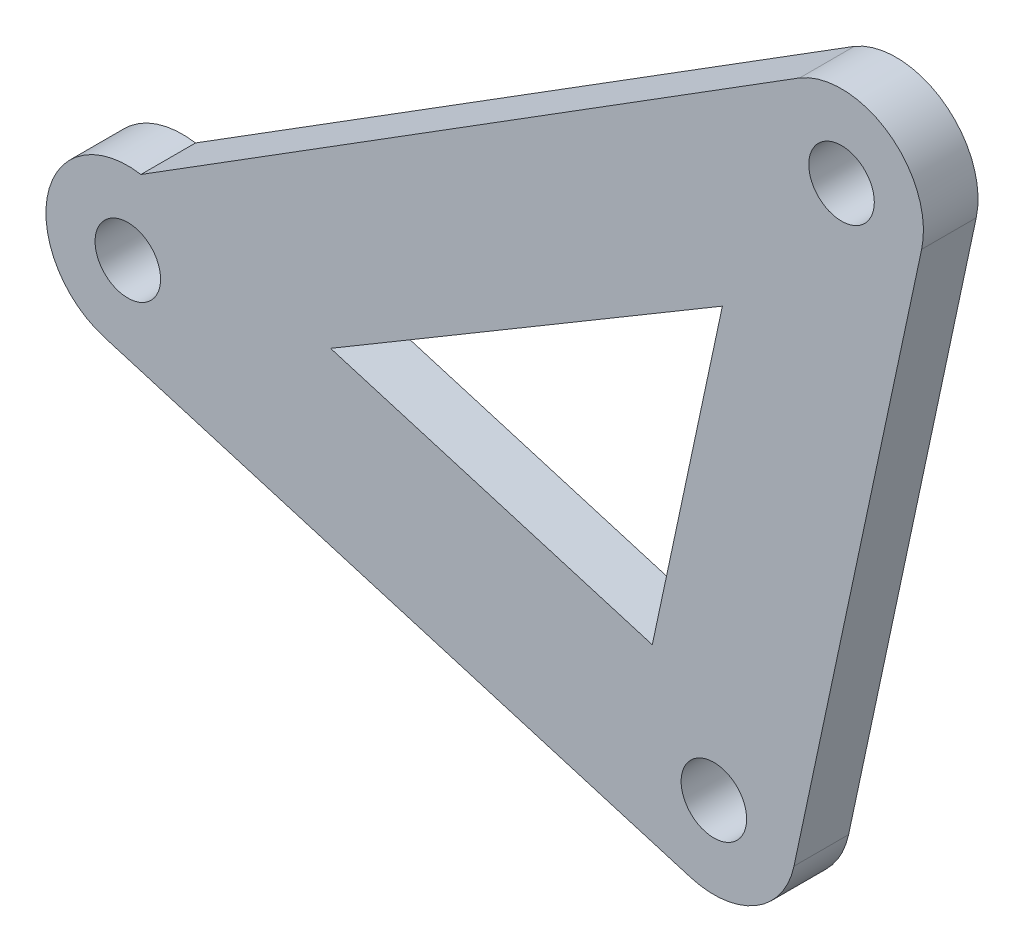
from build123d import *

# Parameters (mm, degrees)
BOSS_EXTRU_1_DEPTH           = 5
ENL_V_MAT_EXTRU_1_DEPTH      = 139.157198597
ENL_V_MAT_EXTRU_1_DEPTH_BACK = 139.157198597
ESQUISSE2_R                  = 3


with BuildPart() as part:
    # Esquisse1 → Boss.-Extru.1 (new body)
    with BuildSketch(Plane.XY):
        with BuildLine():
            ThreePointArc((-116.469329463, 19.389145325), (-124.980595287, 13.660058611), (-119.810809915, 4.797925702))
            Line((-119.810809915, 4.797925702), (-66.140962285, -11.187926022))
            ThreePointArc((-66.140962285, -11.187926022), (-60.173016754, -10.450131722), (-56.665274739, -5.565824173))
            Line((-56.665274739, -5.565824173), (-44.973787584, 49.200124446))
            ThreePointArc((-44.973787584, 49.200124446), (-47.933589905, 56.857750426), (-56.135496091, 57.216080341))
            Line((-56.135496091, 57.216080341), (-116.469329463, 19.389145325))
        make_face()
        Polygon((-99.102905979, 14.281211768), (-63.221488004, 35.570325131), (-69.639764784, 5.505457275), align=None, mode=Mode.SUBTRACT)
    extrude(amount=-BOSS_EXTRU_1_DEPTH)

    # Esquisse2 → Enlèv. mat.-Extru.1 (cut, two sides: drawn at the far end of the back side and taken through both)
    with BuildSketch(Plane.XY.offset(-ENL_V_MAT_EXTRU_1_DEPTH_BACK)):
        with Locations((-117.66984763, 11.985851724)):
            Circle(ESQUISSE2_R)
        with Locations((-64, -4)):
            Circle(ESQUISSE2_R)
        with Locations((-52.308512845, 50.765948619)):
            Circle(ESQUISSE2_R)
    extrude(amount=ENL_V_MAT_EXTRU_1_DEPTH + ENL_V_MAT_EXTRU_1_DEPTH_BACK, mode=Mode.SUBTRACT)


solid = part.part
